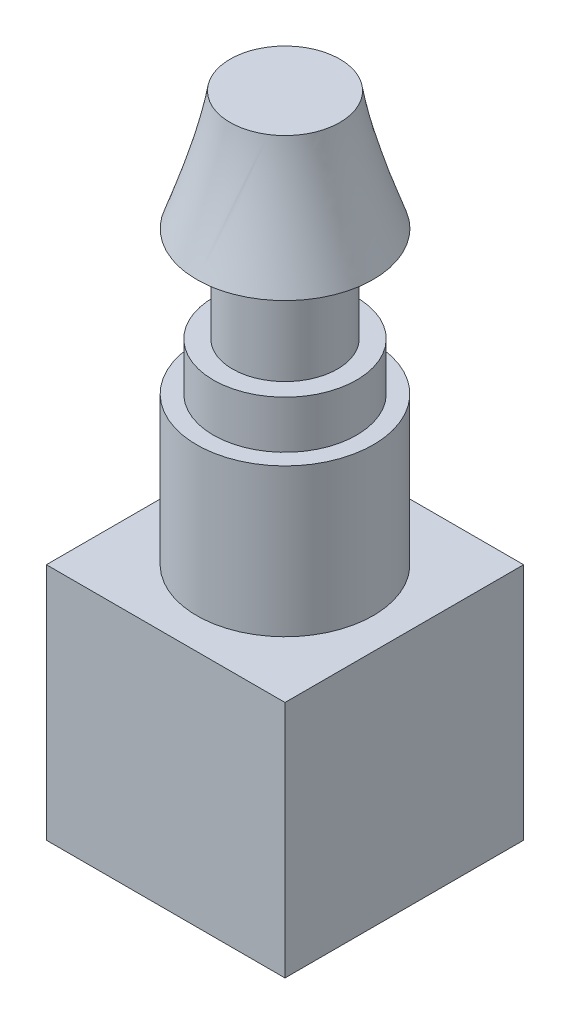
from build123d import *

# Parameters (mm, degrees)
SKETCH1_R           = 1.85
BOSS_EXTRUDE1_DEPTH = 3.1
SKETCH2_R           = 1.5
BOSS_EXTRUDE2_DEPTH = 1
SKETCH3_R           = 1.1
BOSS_EXTRUDE3_DEPTH = 2
SKETCH6_W           = 5
SKETCH6_H           = 5
BOSS_EXTRUDE4_DEPTH = 5


with BuildPart() as part:
    # Sketch1 → Boss-Extrude1 (new body)
    with BuildSketch(Plane(origin=(0, 0, 0), x_dir=(1, 0, 0), z_dir=(0, 1, 0))):
        with Locations(Location((0, 0, 0), (0, 0, 90))):
            Circle(SKETCH1_R)
    extrude(amount=BOSS_EXTRUDE1_DEPTH)

    # Sketch2 → Boss-Extrude2 (add)
    with BuildSketch(Plane(origin=(0, 3.1, 0), x_dir=(1, 0, 0), z_dir=(0, 1, 0))):
        with Locations(Location((0, 0, 0), (0, 0, 270))):
            Circle(SKETCH2_R)
    extrude(amount=BOSS_EXTRUDE2_DEPTH)

    # Sketch3 → Boss-Extrude3 (add)
    with BuildSketch(Plane(origin=(0, 4.1, 0), x_dir=(1, 0, 0), z_dir=(0, 1, 0))):
        with Locations(Location((0, 0, 0), (0, 0, 270))):
            Circle(SKETCH3_R)
    extrude(amount=BOSS_EXTRUDE3_DEPTH)

    # Loft1: read off the stored shape, not the designer's step
    # Loft1: loft between two sections, ruled curve by curve
    loft1_from = [
        Edge.make_bspline([(0, 6.1, 1.85), (3.7, 6.1, 1.85), (3.7, 6.1, -1.85), (0, 6.1, -1.85), (-3.7, 6.1, -1.85), (-3.7, 6.1, 1.85), (0, 6.1, 1.85)], [0, 0, 0, 0, 0.5, 0.5, 0.5, 1, 1, 1, 1], 3, [1, 0.333333333, 0.333333333, 1, 0.333333333, 0.333333333, 1]),
    ]
    loft1_to = [
        Edge.make_bspline([(0.620465421, 8.6, 0.968257539), (2.556980499, 8.6, -0.272673303), (1.316049657, 8.6, -2.209188381), (-0.620465421, 8.6, -0.968257539), (-2.556980499, 8.6, 0.272673303), (-1.316049657, 8.6, 2.209188381), (0.620465421, 8.6, 0.968257539)], [0, 0, 0, 0, 0.5, 0.5, 0.5, 1, 1, 1, 1], 3, [1, 0.333333333, 0.333333333, 1, 0.333333333, 0.333333333, 1]),
    ]
    loft1 = Solid(Shell([*[Face.make_surface_from_curves(loft1_from[k], loft1_to[k]) for k in range(1)], Face(Wire(loft1_from)), Face(Wire(loft1_to))]))
    add(loft1)

    # Sketch6 → Boss-Extrude4 (add)
    with BuildSketch(Plane.XZ):
        Rectangle(SKETCH6_W, SKETCH6_H)
    extrude(amount=BOSS_EXTRUDE4_DEPTH)


solid = part.part
